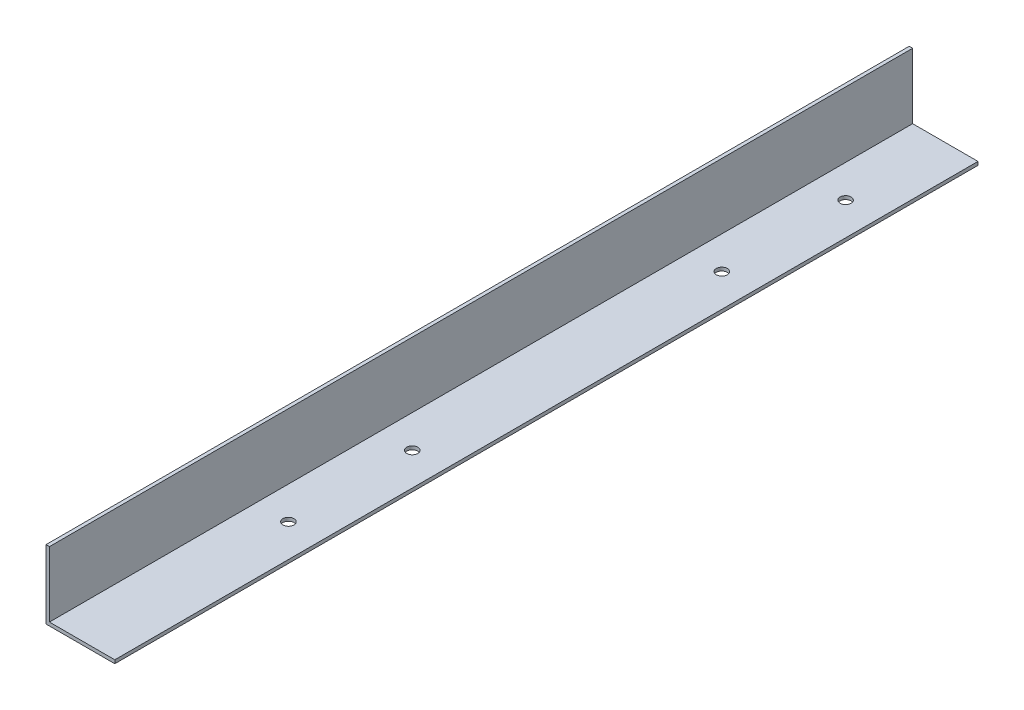
from build123d import *

# Parameters (mm, degrees)
EXTRUDE_1_DEPTH     = 251
SKETCH_3_R          = 1.6
CUT_EXTRUDE_1_DEPTH = 253.511385882


with BuildPart() as part:
    # Эскиз1 → Бобышка-Вытянуть1 (new body)
    with BuildSketch(Plane.XY):
        Polygon((0, 0), (0, 20), (1, 20), (1, 1), (20, 1), (20, 0), align=None)
    extrude(amount=EXTRUDE_1_DEPTH)

    # Эскиз3 → Вырез-Вытянуть1 (cut, through all)
    with BuildSketch(Plane(origin=(0, 1, 0), x_dir=(1, 0, 0), z_dir=(0, 1, 0))):
        with Locations((10.5, -29)):
            Circle(SKETCH_3_R)
        with Locations((10.5, -65)):
            Circle(SKETCH_3_R)
        with Locations((10.5, -155)):
            Circle(SKETCH_3_R)
        with Locations((10.5, -191)):
            Circle(SKETCH_3_R)
    extrude(amount=-CUT_EXTRUDE_1_DEPTH, mode=Mode.SUBTRACT)


solid = part.part
